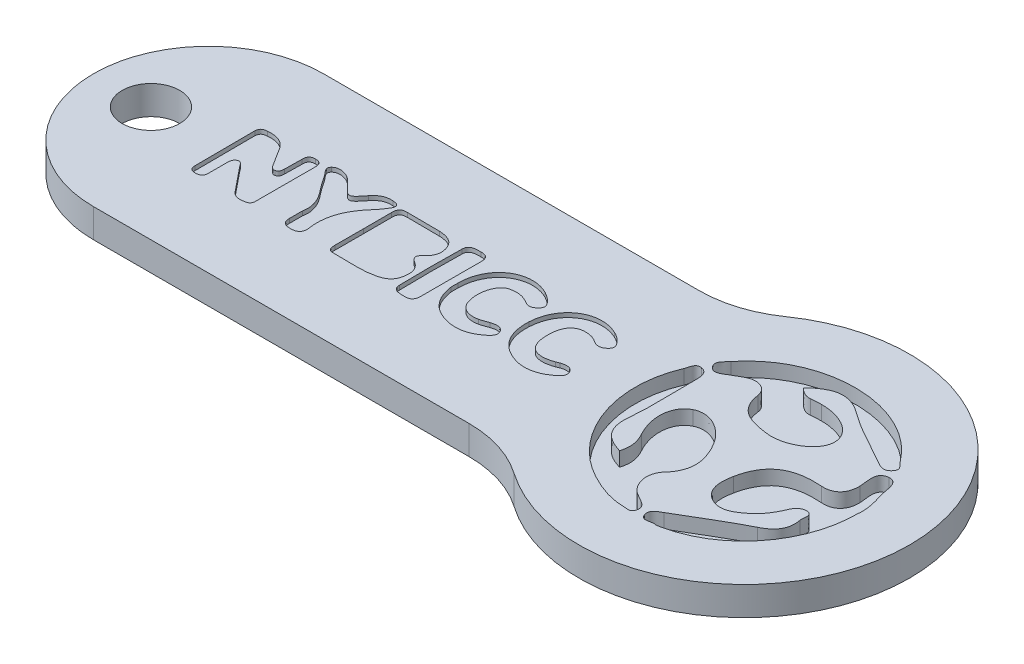
from build123d import *

# Parameters (mm, degrees)
ESQUISSE1_R             = 2
BOSS_EXTRU_1_DEPTH      = 2
ENL_V_MAT_EXTRU_1_DEPTH = 0.3
ENL_V_MAT_EXTRU_2_DEPTH = 1
CONG_1_R                = 8


with BuildPart() as part:
    # Esquisse1 → Boss.-Extru.1 (new body)
    with BuildSketch(Plane(origin=(0, 0, 0), x_dir=(1, 0, 0), z_dir=(0, 1, 0))):
        with BuildLine():
            Line((-18.5, 8), (18.5, 8))
            ThreePointArc((18.5, 8), (38.261355821, 0), (18.5, -8))
            Line((18.5, -8), (-18.5, -8))
            Line((-18.5, -8), (-18.5, 8))
        make_face()
        with Locations(Location((-14.5, 0, 0), (0, 0, 270))):
            Circle(ESQUISSE1_R, mode=Mode.SUBTRACT)
    extrude(amount=BOSS_EXTRU_1_DEPTH)

    # Esquisse4 → Enlèv. mat.-Extru.1 (cut)
    with BuildSketch(Plane(origin=(0, 2, 0), x_dir=(1, 0, 0), z_dir=(0, 1, 0))):
        with BuildLine():
            add(Edge.make_bspline(
                [(-5.179399212, -1.733733576), (-5.181960296, -2.003038068), (-5.100765252, -2.340580256), (-5.46884511, -2.427223029)],
                knots=[1, 1, 1, 1, 2, 2, 2, 2], degree=3))
            add(Edge.make_bspline(
                [(-5.46884511, -2.427223029), (-5.824206365, -2.510827228), (-6.192264519, -2.520550666), (-6.463544084, -2.180664435)],
                knots=[2, 2, 2, 2, 3, 3, 3, 3], degree=3))
            add(Edge.make_bspline(
                [(-6.463544084, -2.180664435), (-6.917159807, -1.612277424), (-7.37596281, -1.0480576), (-7.83687111, -0.48566092)],
                knots=[3, 3, 3, 3, 4, 4, 4, 4], degree=3))
            add(Edge.make_bspline(
                [(-7.83687111, -0.48566092), (-7.953031462, -0.343802912), (-8.052892033, -0.118080256), (-8.285820451, -0.219047737)],
                knots=[4, 4, 4, 4, 5, 5, 5, 5], degree=3))
            add(Edge.make_bspline(
                [(-8.285820451, -0.219047737), (-8.482068937, -0.304214631), (-8.503230436, -0.51778299), (-8.503599406, -0.717026643)],
                knots=[5, 5, 5, 5, 6, 6, 6, 6], degree=3))
            add(Edge.make_bspline(
                [(-8.503599406, -0.717026643), (-8.504337346, -1.145205158), (-8.510132341, -1.573296857), (-8.50689843, -2.001388557)],
                knots=[6, 6, 6, 6, 7, 7, 7, 7], degree=3))
            add(Edge.make_bspline(
                [(-8.50689843, -2.001388557), (-8.512042114, -2.334299424), (-8.69381371, -2.444124348), (-9.002103481, -2.437008874)],
                knots=[7, 7, 7, 7, 8, 8, 8, 8], degree=3))
            add(Edge.make_bspline(
                [(-9.002103481, -2.437008874), (-9.296330826, -2.430134949), (-9.435696319, -2.290063772), (-9.429062297, -2.001388557)],
                knots=[8, 8, 8, 8, 9, 9, 9, 9], degree=3))
            add(Edge.make_bspline(
                [(-9.429062297, -2.001388557), (-9.437185031, -0.610092066), (-9.444070539, 0.781188921), (-9.450826151, 2.172535671)],
                knots=[9, 9, 9, 9, 10, 10, 10, 10], degree=3))
            add(Edge.make_bspline(
                [(-9.450826151, 2.172535671), (-9.436859715, 2.458341505), (-9.289908617, 2.578171994), (-8.999299382, 2.591438078)],
                knots=[10, 10, 10, 10, 11, 11, 11, 11], degree=3))
            add(Edge.make_bspline(
                [(-8.999299382, 2.591438078), (-8.346765568, 2.653424992), (-7.822307658, 2.477925627), (-7.472394133, 1.887704289)],
                knots=[11, 11, 11, 11, 12, 12, 12, 12], degree=3))
            add(Edge.make_bspline(
                [(-7.472394133, 1.887704289), (-7.244153801, 1.502760344), (-6.998007585, 1.128451409), (-6.756289006, 0.751624797)],
                knots=[12, 12, 12, 12, 13, 13, 13, 13], degree=3))
            add(Edge.make_bspline(
                [(-6.756289006, 0.751624797), (-6.662983074, 0.606077092), (-6.556068669, 0.448809172), (-6.356651384, 0.487399065)],
                knots=[13, 13, 13, 13, 14, 14, 14, 14], degree=3))
            add(Edge.make_bspline(
                [(-6.356651384, 0.487399065), (-6.14538366, 0.528202776), (-6.124157048, 0.736735784), (-6.114021233, 0.896043889)],
                knots=[14, 14, 14, 14, 15, 15, 15, 15], degree=3))
            add(Edge.make_bspline(
                [(-6.114021233, 0.896043889), (-6.088345281, 1.301259465), (-6.08765075, 1.70868886), (-6.093923235, 2.115033049)],
                knots=[15, 15, 15, 15, 16, 16, 16, 16], degree=3))
            add(Edge.make_bspline(
                [(-6.093923235, 2.115033049), (-6.09887177, 2.434517424), (-5.970882683, 2.59017924), (-5.639895134, 2.586749992)],
                knots=[16, 16, 16, 16, 17, 17, 17, 17], degree=3))
            add(Edge.make_bspline(
                [(-5.639895134, 2.586749992), (-5.319586004, 2.583450969), (-5.169827703, 2.441245695), (-5.172236858, 2.119721135)],
                knots=[17, 17, 17, 17, 18, 18, 18, 18], degree=3))
            add(Edge.make_bspline(
                [(-5.172236858, 2.119721135), (-5.177489251, 1.413252629), (-5.175383953, 0.706784123), (-5.176035076, 0.000337322)],
                knots=[18, 18, 18, 18, 19, 19, 19, 19], degree=3))
            add(Edge.make_bspline(
                [(-5.176035076, 0.000337322), (-5.176577678, -0.577686311), (-5.174038299, -1.155709943), (-5.179399212, -1.733733576)],
                knots=[0, 0, 0, 0, 1, 1, 1, 1], degree=3))
        make_face()
        with BuildLine():
            add(Edge.make_bspline(
                [(-1.589367181, 2.219733635), (-1.281017011, 2.609539299), (-0.947468378, 2.794154387), (-0.444757978, 2.762336174)],
                knots=[6, 6, 6, 6, 7, 7, 7, 7], degree=3))
            add(Edge.make_bspline(
                [(-0.444757978, 2.762336174), (0.058516729, 2.730474553), (0.108284234, 2.532663371), (-0.136386103, 2.15896215)],
                knots=[7, 7, 7, 7, 8, 8, 8, 8], degree=3))
            add(Edge.make_bspline(
                [(-0.136386103, 2.15896215), (-0.2649612, 1.962540031), (-0.392038715, 1.760474846), (-0.54991435, 1.58862177)],
                knots=[8, 8, 8, 8, 9, 9, 9, 9], degree=3))
            add(Edge.make_bspline(
                [(-0.54991435, 1.58862177), (-1.432381415, 0.627911418), (-1.908916669, -0.461873225), (-1.708349066, -1.796415021)],
                knots=[9, 9, 9, 9, 10, 10, 10, 10], degree=3))
            add(Edge.make_bspline(
                [(-1.708349066, -1.796415021), (-1.634251263, -2.28927176), (-1.886018841, -2.497110236), (-2.382717206, -2.479226056)],
                knots=[10, 10, 10, 10, 11, 11, 11, 11], degree=3))
            add(Edge.make_bspline(
                [(-2.382717206, -2.479226056), (-2.788779242, -2.464727717), (-2.969248846, -2.276075666), (-2.971549481, -1.886704084)],
                knots=[11, 11, 11, 11, 12, 12, 12, 12], degree=3))
            add(Edge.make_bspline(
                [(-2.971549481, -1.886704084), (-2.973047064, -1.629553889), (-2.971223919, -1.372403693), (-2.970746429, -0.986504768)],
                knots=[12, 12, 12, 12, 13, 13, 13, 13], degree=3))
            add(Edge.make_bspline(
                [(-2.970746429, -0.986504768), (-2.823245355, -0.33008592), (-3.134872845, 0.302523528), (-3.613448284, 0.892006926)],
                knots=[0, 0, 0, 0, 1, 1, 1, 1], degree=3))
            add(Edge.make_bspline(
                [(-3.613448284, 0.892006926), (-3.869122601, 1.206759807), (-4.098122576, 1.545083342), (-4.318028533, 1.886402043)],
                knots=[1, 1, 1, 1, 2, 2, 2, 2], degree=3))
            add(Edge.make_bspline(
                [(-4.318028533, 1.886402043), (-4.469436346, 2.121457463), (-4.860023357, 2.376827922), (-4.596861126, 2.643701555)],
                knots=[2, 2, 2, 2, 3, 3, 3, 3], degree=3))
            add(Edge.make_bspline(
                [(-4.596861126, 2.643701555), (-4.345202068, 2.899028605), (-3.899009149, 2.823845598), (-3.56897658, 2.659198283)],
                knots=[3, 3, 3, 3, 4, 4, 4, 4], degree=3))
            add(Edge.make_bspline(
                [(-3.56897658, 2.659198283), (-3.348159051, 2.549028264), (-3.169534295, 2.340278215), (-2.994620941, 2.154404289)],
                knots=[4, 4, 4, 4, 5, 5, 5, 5], degree=3))
            add(Edge.make_bspline(
                [(-2.994620941, 2.154404289), (-2.27463078, 1.389421526), (-2.259850287, 1.372145061), (-1.589367181, 2.219733635)],
                knots=[5, 5, 5, 5, 6, 6, 6, 6], degree=3))
        make_face()
        with BuildLine():
            add(Edge.make_bspline(
                [(0.62837962, -2.452660236), (0.281265924, -2.464380451), (0.223381085, -2.208879767), (0.224987188, -1.924556037)],
                knots=[9, 9, 9, 9, 10, 10, 10, 10], degree=3))
            add(Edge.make_bspline(
                [(0.224987188, -1.924556037), (0.228633477, -1.260931428), (0.227504864, -0.597480451), (0.228286212, 0.066144158)],
                knots=[10, 10, 10, 10, 11, 11, 11, 11], degree=3))
            add(Edge.make_bspline(
                [(0.228286212, 0.066144158), (0.229089264, 0.708216594), (0.242979889, 1.350658), (0.225898761, 1.992318059)],
                knots=[0, 0, 0, 0, 1, 1, 1, 1], degree=3))
            add(Edge.make_bspline(
                [(0.225898761, 1.992318059), (0.215025006, 2.398445207), (0.360594415, 2.577200187), (0.785321978, 2.564611809)],
                knots=[1, 1, 1, 1, 2, 2, 2, 2], degree=3))
            add(Edge.make_bspline(
                [(0.785321978, 2.564611809), (1.533831329, 2.542517033), (2.284445977, 2.579500822), (3.0322825, 2.547595793)],
                knots=[2, 2, 2, 2, 3, 3, 3, 3], degree=3))
            add(Edge.make_bspline(
                [(3.0322825, 2.547595793), (3.534493706, 2.526108732), (4.016064311, 2.387332707), (4.239442925, 1.857622404)],
                knots=[3, 3, 3, 3, 4, 4, 4, 4], degree=3))
            add(Edge.make_bspline(
                [(4.239442925, 1.857622404), (4.454530571, 1.347402385), (4.356862114, 0.893482805), (3.934131328, 0.525902141)],
                knots=[4, 4, 4, 4, 5, 5, 5, 5], degree=3))
            add(Edge.make_bspline(
                [(3.934131328, 0.525902141), (3.614907402, 0.248284978), (3.681842852, 0.030896697), (4.013221074, -0.175031819)],
                knots=[5, 5, 5, 5, 6, 6, 6, 6], degree=3))
            add(Edge.make_bspline(
                [(4.013221074, -0.175031819), (4.531905693, -0.497294319), (4.592156279, -0.987720197), (4.468290971, -1.524940119)],
                knots=[6, 6, 6, 6, 7, 7, 7, 7], degree=3))
            add(Edge.make_bspline(
                [(4.468290971, -1.524940119), (4.352282549, -2.028041193), (3.970333769, -2.237963263), (3.506690752, -2.346831037)],
                knots=[7, 7, 7, 7, 8, 8, 8, 8], degree=3))
            add(Edge.make_bspline(
                [(3.506690752, -2.346831037), (2.554206255, -2.570817365), (1.587874542, -2.420624982), (0.62837962, -2.452660236)],
                knots=[8, 8, 8, 8, 9, 9, 9, 9], degree=3))
        make_face()
        with BuildLine():
            add(Edge.make_bspline(
                [(5.71134998, 2.74358383), (6.112572001, 2.753958391), (6.29946602, 2.567172893), (6.295667802, 2.165603606)],
                knots=[5, 5, 5, 5, 6, 6, 6, 6], degree=3))
            add(Edge.make_bspline(
                [(6.295667802, 2.165603606), (6.288896122, 1.461392326), (6.292281962, 0.757094231), (6.291652543, 0.052861248)],
                knots=[6, 6, 6, 6, 7, 7, 7, 7], degree=3))
            add(Edge.make_bspline(
                [(6.291652543, 0.052861248), (6.291109941, -0.630036604), (6.28883101, -1.313021272), (6.289894511, -1.995919123)],
                knots=[0, 0, 0, 0, 1, 1, 1, 1], degree=3))
            add(Edge.make_bspline(
                [(6.289894511, -1.995919123), (6.29052393, -2.36896922), (6.171889311, -2.60476258), (5.736548442, -2.599119513)],
                knots=[1, 1, 1, 1, 2, 2, 2, 2], degree=3))
            add(Edge.make_bspline(
                [(5.736548442, -2.599119513), (5.332526591, -2.593823713), (4.886789458, -2.605978009), (4.874591753, -2.082561896)],
                knots=[2, 2, 2, 2, 3, 3, 3, 3], degree=3))
            add(Edge.make_bspline(
                [(4.874591753, -2.082561896), (4.840841875, -0.632814729), (4.839561333, 0.818820696), (4.877825664, 2.268437639)],
                knots=[3, 3, 3, 3, 4, 4, 4, 4], degree=3))
            add(Edge.make_bspline(
                [(4.877825664, 2.268437639), (4.890761308, 2.75808217), (5.342445366, 2.733990617), (5.71134998, 2.74358383)],
                knots=[4, 4, 4, 4, 5, 5, 5, 5], degree=3))
        make_face()
        with BuildLine():
            add(Edge.make_bspline(
                [(10.814266409, -2.164256135), (10.026320706, -2.763028888), (9.152687211, -2.818244123), (8.265510355, -2.456393342)],
                knots=[11, 11, 11, 11, 12, 12, 12, 12], degree=3))
            add(Edge.make_bspline(
                [(8.265510355, -2.456393342), (7.376488651, -2.093934846), (6.922395439, -1.369799201), (6.788329203, -0.437217365)],
                knots=[12, 12, 12, 12, 13, 13, 13, 13], degree=3))
            add(Edge.make_bspline(
                [(6.788329203, -0.437217365), (6.764150834, -0.269488069), (6.785290629, -0.095334358), (6.78550767, 0.075867595)],
                knots=[13, 13, 13, 13, 14, 14, 14, 14], degree=3))
            add(Edge.make_bspline(
                [(6.78550767, 0.075867595), (6.771248075, 2.16234799), (8.614078226, 3.420882023), (10.381312991, 2.533401311)],
                knots=[0, 0, 0, 0, 1, 1, 1, 1], degree=3))
            add(Edge.make_bspline(
                [(10.381312991, 2.533401311), (10.606167484, 2.420539982), (10.818694046, 2.259582365), (10.994670901, 2.079655363)],
                knots=[1, 1, 1, 1, 2, 2, 2, 2], degree=3))
            add(Edge.make_bspline(
                [(10.994670901, 2.079655363), (11.171602737, 1.898773381), (11.349142288, 1.656078117), (11.115866605, 1.405091887)],
                knots=[2, 2, 2, 2, 3, 3, 3, 3], degree=3))
            add(Edge.make_bspline(
                [(11.115866605, 1.405091887), (10.92079014, 1.195256633), (10.666070804, 1.062210491), (10.371415921, 1.236494426)],
                knots=[3, 3, 3, 3, 4, 4, 4, 4], degree=3))
            add(Edge.make_bspline(
                [(10.371415921, 1.236494426), (9.994372269, 1.459438957), (9.60274346, 1.610412688), (9.155031253, 1.532798821)],
                knots=[4, 4, 4, 4, 5, 5, 5, 5], degree=3))
            add(Edge.make_bspline(
                [(9.155031253, 1.532798821), (9.030189261, 1.511181535), (8.896578812, 1.499808586), (8.785714261, 1.445461516)],
                knots=[5, 5, 5, 5, 6, 6, 6, 6], degree=3))
            add(Edge.make_bspline(
                [(8.785714261, 1.445461516), (8.229481547, 1.172944817), (7.985679374, 0.128825603), (8.273063383, -0.709039533)],
                knots=[6, 6, 6, 6, 7, 7, 7, 7], degree=3))
            add(Edge.make_bspline(
                [(8.273063383, -0.709039533), (8.464406742, -1.266574494), (8.99520225, -1.533795393), (9.677839652, -1.395757307)],
                knots=[7, 7, 7, 7, 8, 8, 8, 8], degree=3))
            add(Edge.make_bspline(
                [(9.677839652, -1.395757307), (9.884636331, -1.353911799), (10.079539163, -1.255635627), (10.283123636, -1.193909162)],
                knots=[8, 8, 8, 8, 9, 9, 9, 9], degree=3))
            add(Edge.make_bspline(
                [(10.283123636, -1.193909162), (10.603736624, -1.096761604), (10.959423441, -1.04128592), (11.153110843, -1.367455158)],
                knots=[9, 9, 9, 9, 10, 10, 10, 10], degree=3))
            add(Edge.make_bspline(
                [(11.153110843, -1.367455158), (11.365724222, -1.72565965), (11.071329788, -1.969006037), (10.814266409, -2.164256135)],
                knots=[10, 10, 10, 10, 11, 11, 11, 11], degree=3))
        make_face()
        with BuildLine():
            add(Edge.make_bspline(
                [(15.114890725, 1.26128051), (14.952891311, 1.359166008), (14.782731154, 1.465255656), (14.602153029, 1.507057756)],
                knots=[10, 10, 10, 10, 11, 11, 11, 11], degree=3))
            add(Edge.make_bspline(
                [(14.602153029, 1.507057756), (13.592825491, 1.74081093), (13.041367678, 1.232934953), (13.029387014, 0.077256658)],
                knots=[11, 11, 11, 11, 12, 12, 12, 12], degree=3))
            add(Edge.make_bspline(
                [(13.029387014, 0.077256658), (13.015670022, -1.229069807), (13.68320137, -1.713244904), (14.918772463, -1.291924885)],
                knots=[0, 0, 0, 0, 1, 1, 1, 1], degree=3))
            add(Edge.make_bspline(
                [(14.918772463, -1.291924885), (14.999251272, -1.2644909), (15.073566115, -1.21908592), (15.154305373, -1.192867365)],
                knots=[1, 1, 1, 1, 2, 2, 2, 2], degree=3))
            add(Edge.make_bspline(
                [(15.154305373, -1.192867365), (15.480214162, -1.086864533), (15.829563381, -1.064379084), (16.010315138, -1.39132967)],
                knots=[2, 2, 2, 2, 3, 3, 3, 3], degree=3))
            add(Edge.make_bspline(
                [(16.010315138, -1.39132967), (16.211642385, -1.755524494), (15.90327051, -1.991231037), (15.64646758, -2.177799494)],
                knots=[3, 3, 3, 3, 4, 4, 4, 4], degree=3))
            add(Edge.make_bspline(
                [(15.64646758, -2.177799494), (14.786290627, -2.80261717), (13.856313284, -2.846893537), (12.931110842, -2.370358283)],
                knots=[4, 4, 4, 4, 5, 5, 5, 5], degree=3))
            add(Edge.make_bspline(
                [(12.931110842, -2.370358283), (11.898863772, -1.838694611), (11.535276663, -0.87893924), (11.587974222, 0.202966814)],
                knots=[5, 5, 5, 5, 6, 6, 6, 6], degree=3))
            add(Edge.make_bspline(
                [(11.587974222, 0.202966814), (11.685642679, 2.205061662), (13.445584866, 3.336062394), (15.162379299, 2.559229191)],
                knots=[6, 6, 6, 6, 7, 7, 7, 7], degree=3))
            add(Edge.make_bspline(
                [(15.162379299, 2.559229191), (15.399301271, 2.45201093), (15.613390529, 2.315839397), (15.790235549, 2.126970305)],
                knots=[7, 7, 7, 7, 8, 8, 8, 8], degree=3))
            add(Edge.make_bspline(
                [(15.790235549, 2.126970305), (15.982794338, 1.921519279), (16.213986427, 1.683034612), (15.977932619, 1.407870012)],
                knots=[8, 8, 8, 8, 9, 9, 9, 9], degree=3))
            add(Edge.make_bspline(
                [(15.977932619, 1.407870012), (15.760023439, 1.153888616), (15.450522951, 1.05834716), (15.114890725, 1.26128051)],
                knots=[9, 9, 9, 9, 10, 10, 10, 10], degree=3))
        make_face()
    extrude(amount=-ENL_V_MAT_EXTRU_1_DEPTH, mode=Mode.SUBTRACT)

    # Esquisse5 → Enlèv. mat.-Extru.2 (cut)
    with BuildSketch(Plane(origin=(0, 2, 0), x_dir=(1, 0, 0), z_dir=(0, 1, 0))):
        with BuildLine():
            add(Edge.make_bspline(
                [(23.186663146, -6.769797032), (19.809617805, -4.933230685), (18.300149632, -0.679304914), (19.787679299, 2.792463637)],
                knots=[9, 9, 9, 9, 10, 10, 10, 10], degree=3))
            add(Edge.make_bspline(
                [(19.787679299, 2.792463637), (19.903969875, 3.063808315), (19.90182551, 3.526413876), (20.358905207, 3.437257768)],
                knots=[10, 10, 10, 10, 11, 11, 11, 11], degree=3))
            add(Edge.make_bspline(
                [(20.358905207, 3.437257768), (20.775736818, 3.356019316), (20.87586218, 3.003106284), (20.870748693, 2.587676757)],
                knots=[11, 11, 11, 11, 12, 12, 12, 12], degree=3))
            add(Edge.make_bspline(
                [(20.870748693, 2.587676757), (20.851779309, 1.040022388), (20.974997834, -0.519467229), (20.824727316, -2.052853322)],
                knots=[12, 12, 12, 12, 13, 13, 13, 13], degree=3))
            add(Edge.make_bspline(
                [(20.824727316, -2.052853322), (20.689962209, -3.427226486), (21.291704084, -4.053216183), (22.495847638, -4.410995275)],
                knots=[13, 13, 13, 13, 14, 14, 14, 14], degree=3))
            add(Edge.make_bspline(
                [(22.495847638, -4.410995275), (22.689500314, -3.765376388), (22.587395539, -3.237532638), (22.270524338, -2.661688097)],
                knots=[0, 0, 0, 0, 1, 1, 1, 1], degree=3))
            add(Edge.make_bspline(
                [(22.270524338, -2.661688097), (21.485191808, -1.2333759), (21.653277053, 0.156172771), (22.576508761, 0.620386606)],
                knots=[1, 1, 1, 1, 2, 2, 2, 2], degree=3))
            add(Edge.make_bspline(
                [(22.576508761, 0.620386606), (23.507658126, 1.088518032), (24.876752853, 0.314154756), (25.561795069, -1.087229162)],
                knots=[2, 2, 2, 2, 3, 3, 3, 3], degree=3))
            add(Edge.make_bspline(
                [(25.561795069, -1.087229162), (26.074133409, -2.134999006), (26.251950772, -3.132623693), (25.35082252, -4.130743234)],
                knots=[3, 3, 3, 3, 4, 4, 4, 4], degree=3))
            add(Edge.make_bspline(
                [(25.35082252, -4.130743234), (24.736379405, -4.811166818), (24.985950528, -5.909246768), (25.740107286, -6.388759825)],
                knots=[4, 4, 4, 4, 5, 5, 5, 5], degree=3))
            add(Edge.make_bspline(
                [(25.740107286, -6.388759825), (25.911656505, -6.49779255), (26.091783184, -6.593464229), (26.267951036, -6.695239102)],
                knots=[5, 5, 5, 5, 6, 6, 6, 6], degree=3))
            add(Edge.make_bspline(
                [(26.267951036, -6.695239102), (26.529893497, -6.846664278), (26.743505264, -7.040811807), (26.661194629, -7.375167833)],
                knots=[6, 6, 6, 6, 7, 7, 7, 7], degree=3))
            add(Edge.make_bspline(
                [(26.661194629, -7.375167833), (26.55991461, -7.786391104), (26.214012003, -7.63529583), (25.956688175, -7.628862735)],
                knots=[7, 7, 7, 7, 8, 8, 8, 8], degree=3))
            add(Edge.make_bspline(
                [(25.956688175, -7.628862735), (24.954939708, -7.603295303), (24.048368068, -7.23825836), (23.186663146, -6.769797032)],
                knots=[8, 8, 8, 8, 9, 9, 9, 9], degree=3))
        make_face()
        with BuildLine():
            add(Edge.make_bspline(
                [(29.456952041, 3.520475634), (29.409446103, 2.504623842), (27.919937022, 1.549803984), (26.503501309, 1.757642461)],
                knots=[3, 3, 3, 3, 4, 4, 4, 4], degree=3))
            add(Edge.make_bspline(
                [(26.503501309, 1.757642461), (25.335811964, 1.929109204), (24.195669464, 2.169525537), (23.97545965, 3.74307724)],
                knots=[4, 4, 4, 4, 5, 5, 5, 5], degree=3))
            add(Edge.make_bspline(
                [(23.97545965, 3.74307724), (23.890674747, 4.347953188), (23.203983019, 4.748619584), (22.453125285, 4.37294329)],
                knots=[5, 5, 5, 5, 6, 6, 6, 6], degree=3))
            add(Edge.make_bspline(
                [(22.453125285, 4.37294329), (22.198935529, 4.245848412), (21.95414799, 4.098959394), (21.711174914, 3.950998192)],
                knots=[6, 6, 6, 6, 7, 7, 7, 7], degree=3))
            add(Edge.make_bspline(
                [(21.711174914, 3.950998192), (21.36015882, 3.737303949), (20.97582259, 3.449629106), (20.651198684, 3.911574862)],
                knots=[7, 7, 7, 7, 8, 8, 8, 8], degree=3))
            add(Edge.make_bspline(
                [(20.651198684, 3.911574862), (20.37061674, 4.311086601), (20.809056955, 4.578389975), (21.005183898, 4.828868329)],
                knots=[8, 8, 8, 8, 9, 9, 9, 9], degree=3))
            add(Edge.make_bspline(
                [(21.005183898, 4.828868329), (23.928283614, 8.56352781), (30.092343955, 8.488392552), (32.918122479, 4.687917553)],
                knots=[9, 9, 9, 9, 10, 10, 10, 10], degree=3))
            add(Edge.make_bspline(
                [(32.918122479, 4.687917553), (33.085218016, 4.463171581), (33.509967284, 4.24906496), (33.194745595, 3.874873227)],
                knots=[10, 10, 10, 10, 11, 11, 11, 11], degree=3))
            add(Edge.make_bspline(
                [(33.194745595, 3.874873227), (32.899647948, 3.524434462), (32.5761787, 3.664642958), (32.22565746, 3.874130946)],
                knots=[11, 11, 11, 11, 12, 12, 12, 12], degree=3))
            add(Edge.make_bspline(
                [(32.22565746, 3.874130946), (30.969719238, 4.624658778), (29.615800019, 5.237122479), (28.44893543, 6.103610985)],
                knots=[12, 12, 12, 12, 13, 13, 13, 13], degree=3))
            add(Edge.make_bspline(
                [(28.44893543, 6.103610985), (27.188048672, 7.040038787), (26.193393106, 6.833107542), (25.100591593, 5.772636459)],
                knots=[13, 13, 13, 13, 14, 14, 14, 14], degree=3))
            add(Edge.make_bspline(
                [(25.100591593, 5.772636459), (25.3971738, 5.479930604), (25.666374112, 5.331886927), (26.013596329, 5.360258529)],
                knots=[0, 0, 0, 0, 1, 1, 1, 1], degree=3))
            add(Edge.make_bspline(
                [(26.013596329, 5.360258529), (26.256899307, 5.380217621), (26.50086209, 5.404218016), (26.744494971, 5.402403553)],
                knots=[1, 1, 1, 1, 2, 2, 2, 2], degree=3))
            add(Edge.make_bspline(
                [(26.744494971, 5.402403553), (28.303283545, 5.391021923), (29.505447685, 4.55381225), (29.456952041, 3.520475634)],
                knots=[2, 2, 2, 2, 3, 3, 3, 3], degree=3))
        make_face()
        with BuildLine():
            add(Edge.make_bspline(
                [(28.008680752, -2.001388557), (28.386418936, -0.107419202), (29.587098515, 0.635397163), (31.650307773, 0.477786318)],
                knots=[11, 11, 11, 11, 12, 12, 12, 12], degree=3))
            add(Edge.make_bspline(
                [(31.650307773, 0.477786318), (32.417990526, 0.419063701), (33.010660087, 0.836142739), (32.989876239, 1.811746445)],
                knots=[12, 12, 12, 12, 13, 13, 13, 13], degree=3))
            add(Edge.make_bspline(
                [(32.989876239, 1.811746445), (32.978164706, 2.360538994), (32.650406728, 3.276925229), (33.476812098, 3.344967587)],
                knots=[13, 13, 13, 13, 14, 14, 14, 14], degree=3))
            add(Edge.make_bspline(
                [(33.476812098, 3.344967587), (34.182473212, 3.403277826), (34.110719452, 2.450684809), (34.290846131, 1.919624511)],
                knots=[14, 14, 14, 14, 15, 15, 15, 15], degree=3))
            add(Edge.make_bspline(
                [(34.290846131, 1.919624511), (34.511550799, 1.269222041), (34.657202684, 0.583272593), (34.572252831, 0.043016267)],
                knots=[15, 15, 15, 15, 16, 16, 16, 16], degree=3))
            add(Edge.make_bspline(
                [(34.572252831, 0.043016267), (34.557242274, -3.684715265), (31.980540019, -6.861509883), (28.528111992, -7.568985459)],
                knots=[0, 0, 0, 0, 1, 1, 1, 1], degree=3))
            add(Edge.make_bspline(
                [(28.528111992, -7.568985459), (28.409347149, -7.593233282), (28.279365625, -7.630677198), (28.166703975, -7.606264424)],
                knots=[1, 1, 1, 1, 2, 2, 2, 2], degree=3))
            add(Edge.make_bspline(
                [(28.166703975, -7.606264424), (27.847688408, -7.537479786), (27.395062393, -7.903011582), (27.221038907, -7.385394805)],
                knots=[2, 2, 2, 2, 3, 3, 3, 3], degree=3))
            add(Edge.make_bspline(
                [(27.221038907, -7.385394805), (27.065984805, -6.923366573), (27.456754131, -6.765673253), (27.778408916, -6.581257842)],
                knots=[3, 3, 3, 3, 4, 4, 4, 4], degree=3))
            add(Edge.make_bspline(
                [(27.778408916, -6.581257842), (29.151792373, -5.793780948), (30.49004123, -4.937849317), (31.901363456, -4.226579865)],
                knots=[4, 4, 4, 4, 5, 5, 5, 5], degree=3))
            add(Edge.make_bspline(
                [(31.901363456, -4.226579865), (32.758779647, -3.794737697), (33.131239393, -3.238522345), (32.960349979, -2.315290637)],
                knots=[5, 5, 5, 5, 6, 6, 6, 6], degree=3))
            add(Edge.make_bspline(
                [(32.960349979, -2.315290637), (32.90839036, -2.033883937), (33.154827411, -1.581257922), (32.667231747, -1.528308596)],
                knots=[6, 6, 6, 6, 7, 7, 7, 7], degree=3))
            add(Edge.make_bspline(
                [(32.667231747, -1.528308596), (32.350195595, -1.493998752), (32.043386415, -1.733177951), (31.914889452, -2.047739836)],
                knots=[7, 7, 7, 7, 8, 8, 8, 8], degree=3))
            add(Edge.make_bspline(
                [(31.914889452, -2.047739836), (31.664328622, -2.660368488), (31.338550058, -3.217903449), (30.828521035, -3.640178449)],
                knots=[8, 8, 8, 8, 9, 9, 9, 9], degree=3))
            add(Edge.make_bspline(
                [(30.828521035, -3.640178449), (30.215067627, -4.148228058), (29.523757265, -4.58204964), (28.723249229, -4.145918742)],
                knots=[9, 9, 9, 9, 10, 10, 10, 10], degree=3))
            add(Edge.make_bspline(
                [(28.723249229, -4.145918742), (27.87045167, -3.681416242), (27.841750166, -2.838515754), (28.008680752, -2.001388557)],
                knots=[10, 10, 10, 10, 11, 11, 11, 11], degree=3))
        make_face()
    extrude(amount=-ENL_V_MAT_EXTRU_2_DEPTH, mode=Mode.SUBTRACT)

    # Congé1
    cong_1_edges = [part.edges().sort_by_distance(p)[0] for p in [
        (18.5, 1, -8),
        (-18.5, 1, -8),
        (18.5, 1, 8),
        (-18.5, 1, 8),
    ]]
    fillet(cong_1_edges, radius=CONG_1_R - 0.0001)  # a hair under: the kernel refuses the full size


solid = part.part
